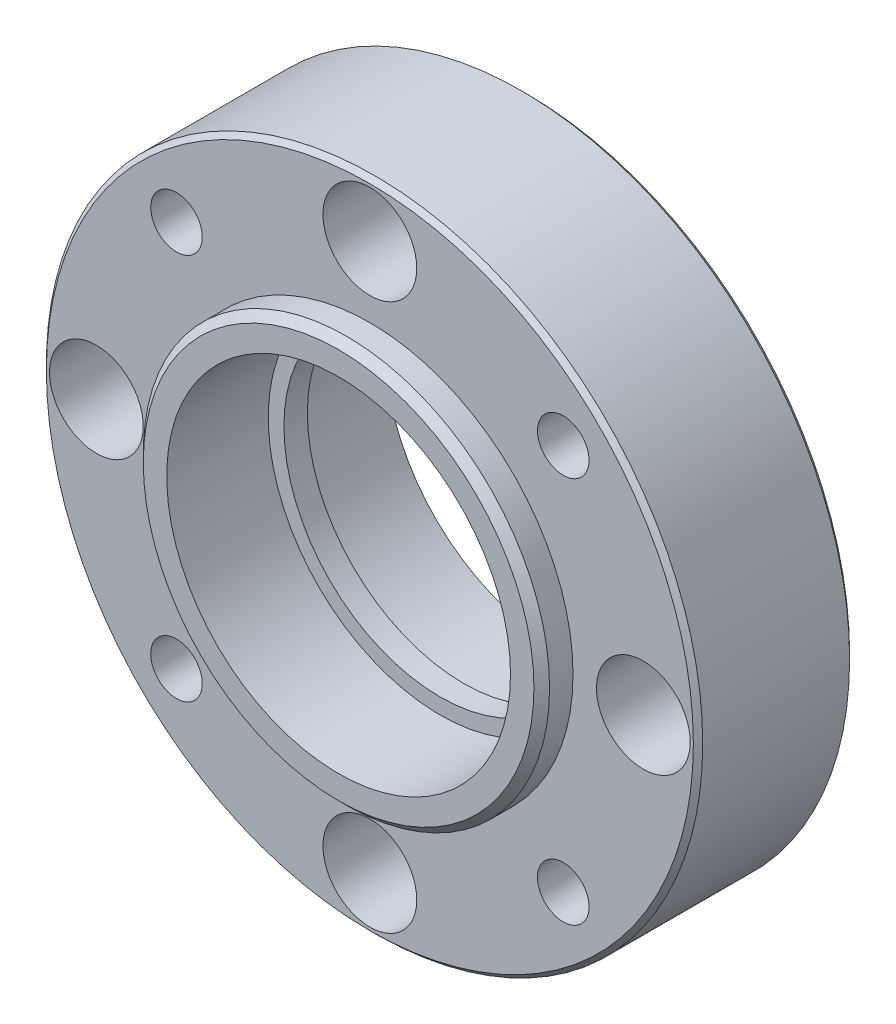
from build123d import *

# Parameters (mm, degrees)
SKETCH_1_W                   = 21
SKETCH_1_H                   = 10
SKETCH_2_R                   = 13.4
EXTRUDE_1_DEPTH              = 2
SKETCH_3_R                   = 13
EXTRUDE_2_DEPTH              = 2
HOLE_WIZARD_M3_1_D           = 3.5
HOLE_WIZARD_M3_1_DEPTH       = 12
HOLE_WIZARD_M3_1_CBORE_D     = 6
HOLE_WIZARD_M3_1_CBORE_DEPTH = 5
HOLE_WIZARD_3_3_3_3_1_D      = 3.3
HOLE_WIZARD_3_3_3_3_1_DEPTH  = 12
CHAMFER_1_SIZE               = 0.3
CHAMFER_2_SIZE               = 0.5


with BuildPart() as part:
    # 草图1 → 旋转1 (revolve)
    with BuildSketch(Plane(origin=(0, 0, 0), x_dir=(1, 0, 0), z_dir=(0, 1, 0))):
        with Locations((10.5, 0)):
            Rectangle(SKETCH_1_W, SKETCH_1_H)
    revolve(axis=Axis((0, 0, -5), (0, 0, 1)))

    # 草图2 → 凸台-拉伸1 (add)
    with BuildSketch(Plane(origin=(0, 0, -5), x_dir=(-1, 0, 0), z_dir=(0, 0, -1))):
        Circle(SKETCH_2_R)
    extrude(amount=EXTRUDE_1_DEPTH)

    # 草图3 → 凸台-拉伸2 (add)
    with BuildSketch(Plane.XY.offset(5)):
        Circle(SKETCH_3_R)
    extrude(amount=EXTRUDE_2_DEPTH)

    # 草图4 → 切除-旋转1 (revolve, cut)
    with BuildSketch(Plane(origin=(0, 0, 0), x_dir=(1, 0, 0), z_dir=(0, 1, 0))):
        Polygon((11, 7), (0, 7), (0, -7), (11, -7), (11, -0.5), (10, -0.5), (10, 1), (11, 1), align=None)
    revolve(axis=Axis((0, 0, -7), (0, 0, 1)), mode=Mode.SUBTRACT)

    # M3 六角头机械螺钉的柱形沉头孔1
    with Locations(Plane.XY.offset(5)):
        with Locations((0, 17.5), (17.5, 0), (0, -17.5), (-17.5, 0)):
            CounterBoreHole(HOLE_WIZARD_M3_1_D / 2, HOLE_WIZARD_M3_1_CBORE_D / 2, HOLE_WIZARD_M3_1_CBORE_DEPTH, depth=HOLE_WIZARD_M3_1_DEPTH)

    # Ø3.3 (3.3) 直径孔1
    with Locations(Plane(origin=(0, 0, -5), x_dir=(-1, 0, 0), z_dir=(0, 0, -1))):
        with Locations((12.374368671, 12.374368671), (-12.374368671, 12.374368671), (-12.374368671, -12.374368671), (12.374368671, -12.374368671)):
            Hole(HOLE_WIZARD_3_3_3_3_1_D / 2, depth=HOLE_WIZARD_3_3_3_3_1_DEPTH)

    # 倒角1
    chamfer_1_edges = [part.edges().sort_by_distance(p)[0] for p in [
        (-21, 0, -5),
        (-21, 0, 5),
    ]]
    chamfer(chamfer_1_edges, length=CHAMFER_1_SIZE)

    # 倒角2
    chamfer_2_edges = [part.edges().sort_by_distance(p)[0] for p in [
        (-13, 0, 7),
        (13.4, 0, -7),
    ]]
    chamfer(chamfer_2_edges, length=CHAMFER_2_SIZE)


solid = part.part
